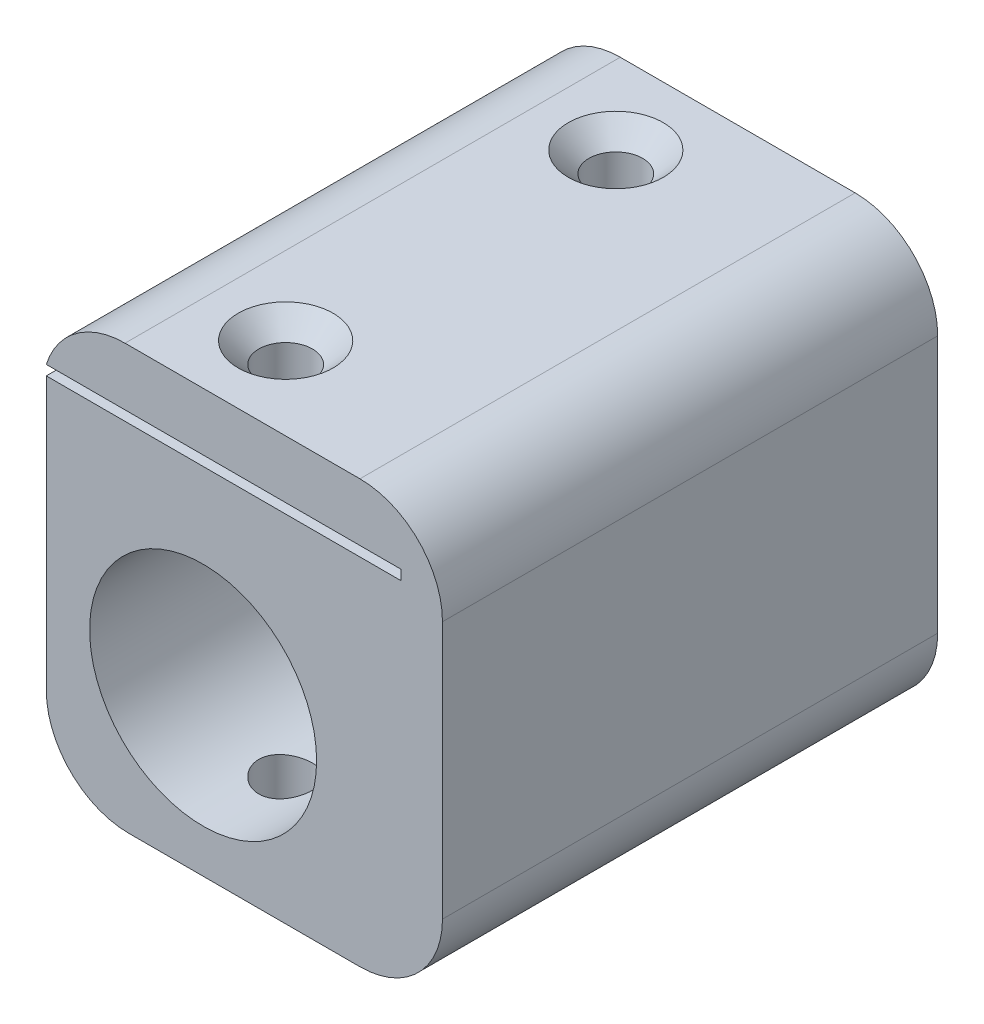
from build123d import *

# Parameters (mm, degrees)
SKETCH1_W           = 43
SKETCH1_H           = 43
SKETCH1_R           = 13.75
SKETCH1_H_2         = 7
BOSS_EXTRUDE1_DEPTH = 60
SKETCH3_R           = 3.25
CUT_EXTRUDE5_DEPTH  = 85.038324591
CHAMFER2_SIZE       = 2.5
CUT_EXTRUDE6_START  = -38
CUT_EXTRUDE6_DEPTH  = 15
FILLET1_R           = 10


with BuildPart() as part:
    # Sketch1 → Boss-Extrude1 (new body)
    # profile 1 of 3: a face of its own
    with BuildSketch(Plane.XY):
        with Locations((2.5, 2.5)):
            Rectangle(SKETCH1_W, SKETCH1_H)
        Circle(SKETCH1_R, mode=Mode.SUBTRACT)
    # profile 2 of 3: a face of its own
    with BuildSketch(Plane.XY):
        with Locations((2.5, 28.7)):
            Rectangle(SKETCH1_W, SKETCH1_H_2)
    # profile 3 of 3: a face of its own
    with BuildSketch(Plane.XY):
        Polygon((24, 24), (24, -19), (29, -19), (29, 32.2), (24, 32.2), (24, 25.2), align=None)
    extrude(amount=BOSS_EXTRUDE1_DEPTH)

    # Sketch3 → Cut-Extrude5 (cut, through all)
    with BuildSketch(Plane(origin=(0, 32.2, 0), x_dir=(1, 0, 0), z_dir=(0, 1, 0))):
        with Locations(Location((0, -50, 0), (0, 0, 270))):
            Circle(SKETCH3_R)
        with Locations(Location((0, -10, 0), (0, 0, 270))):
            Circle(SKETCH3_R)
    extrude(amount=-CUT_EXTRUDE5_DEPTH, mode=Mode.SUBTRACT)

    # Chamfer2
    chamfer2_edges = [part.edges().sort_by_distance(p)[0] for p in [
        (0, 32.2, 46.75),
        (0, 32.2, 6.75),
    ]]
    chamfer(chamfer2_edges, length=CHAMFER2_SIZE)

    # Sketch7 → Cut-Extrude6 (cut)
    with BuildSketch(Plane.XZ.offset(19).offset(CUT_EXTRUDE6_START)):
        Polygon((0, 43.533676985), (5.6, 46.766838493), (5.6, 53.233161507), (0, 56.466323015), (-5.6, 53.233161507), (-5.6, 46.766838493), align=None)
        Polygon((-5.6, 13.233161507), (0, 16.466323015), (5.6, 13.233161507), (5.6, 6.766838493), (0, 3.533676985), (-5.6, 6.766838493), align=None)
    extrude(amount=CUT_EXTRUDE6_DEPTH, mode=Mode.SUBTRACT)

    # Fillet1
    # the kernel refuses this fillet: 10 mm, written as the material it takes off along each edge
    with BuildSketch(Plane(origin=(-19, -19, -25), x_dir=(1, 0, 0), z_dir=(0, 0, 1)), Plane(origin=(29, 32.2, -25), x_dir=(-1, 0, 0), z_dir=(0, 0, 1)), Plane(origin=(29, -19, -25), x_dir=(0, 1, 0), z_dir=(0, 0, 1))) as fillet1_piece_1:
        with BuildLine():
            CenterArc((FILLET1_R, FILLET1_R), FILLET1_R, 180, 90)
            Line((0, FILLET1_R), (-FILLET1_R * 0.02, FILLET1_R))
            Line((-FILLET1_R * 0.02, FILLET1_R), (-FILLET1_R * 0.02, -FILLET1_R * 0.02))
            Line((-FILLET1_R * 0.02, -FILLET1_R * 0.02), (FILLET1_R, -FILLET1_R * 0.02))
            Line((FILLET1_R, -FILLET1_R * 0.02), (FILLET1_R, 0))
        make_face()
    extrude(amount=110, mode=Mode.SUBTRACT)
    with BuildSketch(Plane(origin=(-19, 32.2, -23.848480035), x_dir=(1, 0, 0), z_dir=(0, 0, 1))) as fillet1_piece_2:
        with BuildLine():
            CenterArc((9.539392014, -10), FILLET1_R, 90, 72.542396876)
            Line((0, -7), (-0.19078784, -6.94))
            ThreePointArc((-0.19078784, -6.94), (-0.2, -3.5), (-0.2, 0))
            Line((-0.2, 0), (0, 0.2))
            Line((0, 0.2), (9.539392014, 0.2))
            Line((9.539392014, 0.2), (9.539392014, 0))
        make_face()
    extrude(amount=107.696960071, mode=Mode.SUBTRACT)


solid = part.part
